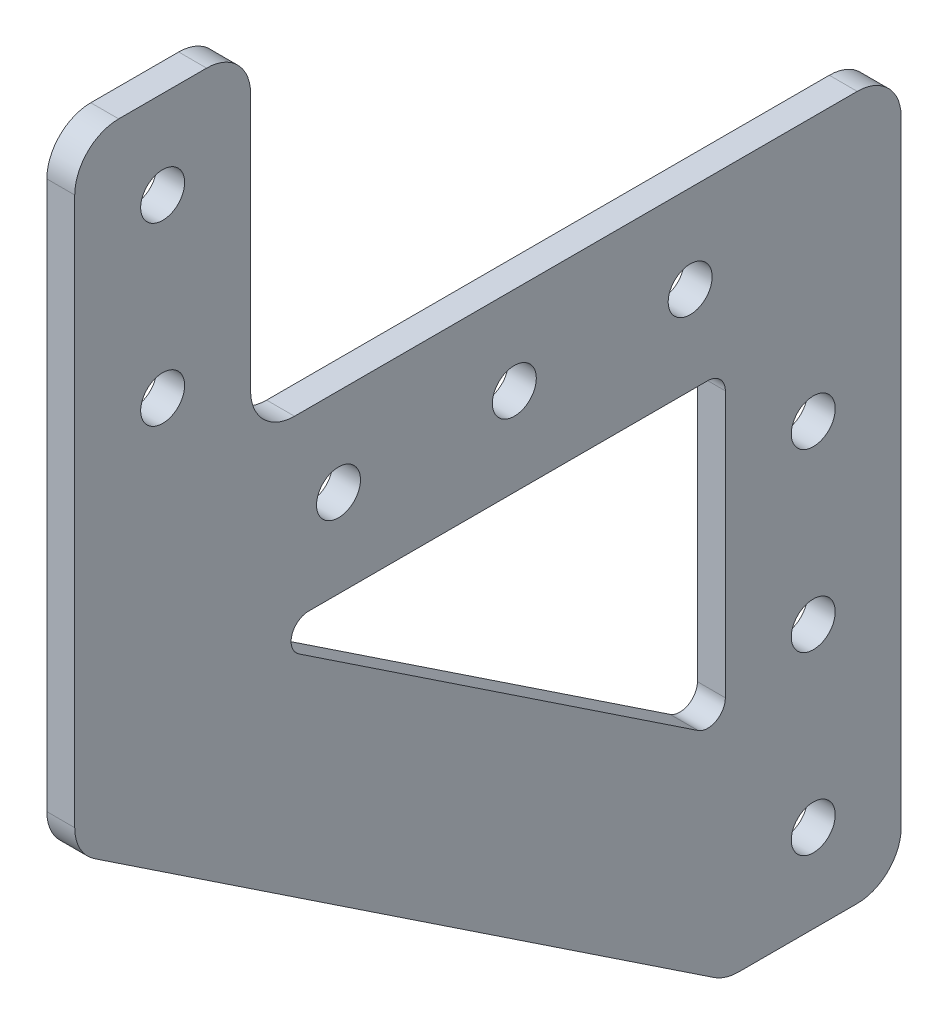
from build123d import *
from OCP.BRepFilletAPI import BRepFilletAPI_MakeFillet

# Parameters (mm, degrees)
SKETCH2_R           = 2.5
BOSS_EXTRUDE1_DEPTH = 3.175
FILLET1_R1          = 5
FILLET1_R2          = 2


with BuildPart() as part:
    # Sketch2 → Boss-Extrude1 (new body)
    with BuildSketch(Plane(origin=(0, 0, 0), x_dir=(0, 0, -1), z_dir=(1, 0, 0))):
        Polygon((-47, 49.291259303), (-27, 49.291259303), (-27, 10), (47, 10), (47, -70), (27, -70), (-47, -20.708740697), align=None)
        with Locations((-37, 39.291259303)):
            Circle(SKETCH2_R, mode=Mode.SUBTRACT)
        with Locations((-37, 19.291259303)):
            Circle(SKETCH2_R, mode=Mode.SUBTRACT)
        with Locations((37, -60)):
            Circle(SKETCH2_R, mode=Mode.SUBTRACT)
        with Locations((37, -40)):
            Circle(SKETCH2_R, mode=Mode.SUBTRACT)
        with Locations((37, -20)):
            Circle(SKETCH2_R, mode=Mode.SUBTRACT)
        with Locations((-17, 0)):
            Circle(SKETCH2_R, mode=Mode.SUBTRACT)
        with Locations((3, 0)):
            Circle(SKETCH2_R, mode=Mode.SUBTRACT)
        with Locations((23, 0)):
            Circle(SKETCH2_R, mode=Mode.SUBTRACT)
        Polygon((27, -45.96929733), (27, -10), (-27, -10), align=None, mode=Mode.SUBTRACT)
    extrude(amount=BOSS_EXTRUDE1_DEPTH)

    # Fillet1: one fillet with a radius per group of edges: ONE call of the kernel's fillet builder (fillet() takes one radius for all edges)
    fillet1_edges_1 = [part.edges().sort_by_distance(p)[0] for p in [
        (1.5875, 49.291259303, 47),
        (1.5875, 49.291259303, 27),
        (1.5875, 10, 27),
        (1.5875, 10, -47),
        (1.5875, -70, -47),
        (1.5875, -70, -27),
        (1.5875, -20.708740697, 47),
    ]]
    fillet1_edges_2 = [part.edges().sort_by_distance(p)[0] for p in [
        (1.5875, -10, -27),
        (1.5875, -10, 27),
        (1.5875, -45.96929733, -27),
    ]]
    fillet1 = BRepFilletAPI_MakeFillet(part.part.solid().wrapped)
    for e in fillet1_edges_1:
        fillet1.Add(FILLET1_R1, e.wrapped)
    for e in fillet1_edges_2:
        fillet1.Add(FILLET1_R2, e.wrapped)
    add(Compound.cast(fillet1.Shape()), mode=Mode.REPLACE)


solid = part.part
